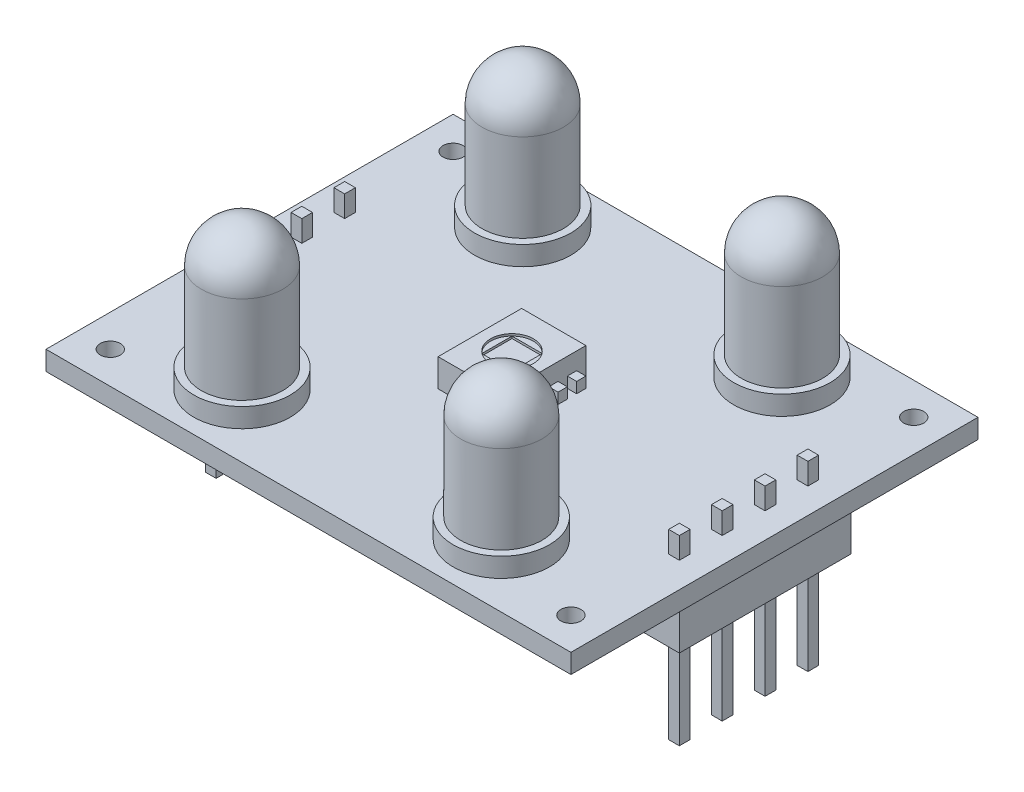
from build123d import *

# Parameters (mm, degrees)
ESQUISSE1_W             = 31.115
ESQUISSE1_H             = 24.13
ESQUISSE1_R             = 0.5953125
BOSS_EXTRU_1_DEPTH      = 0.5715
ESQUISSE2_W             = 3.81
ESQUISSE2_H             = 1.651
BOSS_EXTRU_2_DEPTH      = 2.4765
ESQUISSE3_W             = 0.550333333
ESQUISSE3_H             = 0.550333334
ESQUISSE3_H_2           = 0.550333333
BOSS_EXTRU_3_DEPTH      = 0.635
ESQUISSE9_W             = 2.54
ESQUISSE9_H             = 10.16
BOSS_EXTRU_6_DEPTH      = 2.667
BOSS_EXTRU_7_START      = -5.08
ESQUISSE10_W            = 0.635
ESQUISSE10_H            = 0.635
BOSS_EXTRU_7_DEPTH      = 10.795
ESQUISSE4_R             = 1.27
ENL_V_MAT_EXTRU_1_DEPTH = 0.127
ESQUISSE5_W             = 1.796051224
ESQUISSE5_H             = 1.796051224
ENL_V_MAT_EXTRU_2_DEPTH = 0.127
ESQUISSE7_R             = 2.8575
BOSS_EXTRU_4_DEPTH      = 1.143
ESQUISSE8_R             = 2.413
BOSS_EXTRU_5_DEPTH      = 7.62
CONG_1_R                = 2.413


# Read off the part's stored shape, not the designer's step: Répét. par esquisse1
with BuildPart() as part:
    # Esquisse1 → Boss.-Extru.1 (new, symmetric)
    with BuildSketch(Plane(origin=(0, 0, 0), x_dir=(1, 0, 0), z_dir=(0, 1, 0))):
        Rectangle(ESQUISSE1_W, ESQUISSE1_H)
        with Locations(Location((-13.6525, 10.16, 0), (0, 0, 270))):
            Circle(ESQUISSE1_R, mode=Mode.SUBTRACT)
        with Locations(Location((13.6525, 10.16, 0), (0, 0, 270))):
            Circle(ESQUISSE1_R, mode=Mode.SUBTRACT)
        with Locations(Location((-13.6525, -10.16, 0), (0, 0, 270))):
            Circle(ESQUISSE1_R, mode=Mode.SUBTRACT)
        with Locations(Location((13.6525, -10.16, 0), (0, 0, 270))):
            Circle(ESQUISSE1_R, mode=Mode.SUBTRACT)
    extrude(amount=BOSS_EXTRU_1_DEPTH, both=True)

    # Esquisse2 → Boss.-Extru.2 (add, symmetric)
    with BuildSketch(Plane.XY):
        with Locations((0, 1.397)):
            Rectangle(ESQUISSE2_W, ESQUISSE2_H)
    extrude(amount=BOSS_EXTRU_2_DEPTH, both=True)

    # Esquisse3 → Boss.-Extru.3 (add)
    with BuildSketch(Plane(origin=(0, 0.5715, 0), x_dir=(1, 0, 0), z_dir=(0, 1, 0))):
        with Locations((2.180166666, 1.651)):
            Rectangle(ESQUISSE3_W, ESQUISSE3_H)
        with Locations((2.180166666, 0.550333334)):
            Rectangle(ESQUISSE3_W, ESQUISSE3_H_2)
        with Locations((2.180166666, -0.550333334)):
            Rectangle(ESQUISSE3_W, ESQUISSE3_H_2)
        with Locations((2.180166666, -1.651)):
            Rectangle(ESQUISSE3_W, ESQUISSE3_H)
    boss_extru_3 = extrude(amount=BOSS_EXTRU_3_DEPTH)

    # Esquisse9 → Boss.-Extru.6 (add)
    with BuildSketch(Plane.XZ.offset(0.5715)):
        with Locations((13.73, 0)):
            Rectangle(ESQUISSE9_W, ESQUISSE9_H)
    boss_extru_6 = extrude(amount=BOSS_EXTRU_6_DEPTH)

    # Esquisse10 → Boss.-Extru.7 (add)
    with BuildSketch(Plane.XZ.offset(3.2385).offset(BOSS_EXTRU_7_START)):
        with Locations((13.73, 3.81)):
            Rectangle(ESQUISSE10_W, ESQUISSE10_H)
        with Locations((13.73, 1.27)):
            Rectangle(ESQUISSE10_W, ESQUISSE10_H)
        with Locations((13.73, -1.27)):
            Rectangle(ESQUISSE10_W, ESQUISSE10_H)
        with Locations((13.73, -3.81)):
            Rectangle(ESQUISSE10_W, ESQUISSE10_H)
    boss_extru_7 = extrude(amount=BOSS_EXTRU_7_DEPTH)

    # Symétrie1: Boss.-Extru.3, Boss.-Extru.7 across plane
    add(boss_extru_3.mirror(Plane(origin=(0, 0, 0), x_dir=(0, 0, 1), z_dir=(1, 0, 0))))
    add(boss_extru_7.mirror(Plane(origin=(0, 0, 0), x_dir=(0, 0, 1), z_dir=(1, 0, 0))))

    # Symétrie2: Boss.-Extru.6 across plane
    add(boss_extru_6.mirror(Plane(origin=(0, 0, 0), x_dir=(0, 0, 1), z_dir=(1, 0, 0))))

    # Esquisse4 → Enlèv. mat.-Extru.1 (cut)
    with BuildSketch(Plane(origin=(0, 2.2225, 0), x_dir=(1, 0, 0), z_dir=(0, 1, 0))):
        with Locations(Location((0, 0, 0), (0, 0, 270))):
            Circle(ESQUISSE4_R)
    extrude(amount=-ENL_V_MAT_EXTRU_1_DEPTH, mode=Mode.SUBTRACT)

    # Esquisse5 → Enlèv. mat.-Extru.2 (cut)
    with BuildSketch(Plane(origin=(0, 2.0955, 0), x_dir=(1, 0, 0), z_dir=(0, 1, 0))):
        Rectangle(ESQUISSE5_W, ESQUISSE5_H)
    extrude(amount=-ENL_V_MAT_EXTRU_2_DEPTH, mode=Mode.SUBTRACT)

    # Esquisse7 → Boss.-Extru.4 (add)
    with BuildSketch(Plane(origin=(0, 0.5715, 0), x_dir=(1, 0, 0), z_dir=(0, 1, 0))):
        with Locations(Location((-7.6835, 8.3185, 0), (0, 0, 90))):
            Circle(ESQUISSE7_R)
    extrude(amount=BOSS_EXTRU_4_DEPTH)

    # Esquisse8 → Boss.-Extru.5 (add)
    with BuildSketch(Plane(origin=(0, 1.7145, 0), x_dir=(1, 0, 0), z_dir=(0, 1, 0))):
        with Locations(Location((-7.6835, 8.3185, 0), (0, 0, 90))):
            Circle(ESQUISSE8_R)
    extrude(amount=BOSS_EXTRU_5_DEPTH)

    # Congé1
    cong_1_edges = [part.edges().sort_by_distance(p)[0] for p in [
        (-7.6835, 9.3345, -5.9055),
    ]]
    fillet(cong_1_edges, radius=CONG_1_R)

    # Répét. par esquisse1 outline → Répét. par esquisse1 (revolve)
    with BuildSketch(Plane(origin=(7.6835, 0, -8.3185), x_dir=(1, 0, 0), z_dir=(0, 0, 1))):
        with BuildLine():
            Line((0, 0.5715), (2.8575, 0.5715))
            Line((2.8575, 0.5715), (2.8575, 1.7145))
            Line((2.8575, 1.7145), (2.413, 1.7145))
            Line((2.413, 1.7145), (2.413, 6.921499998))
            ThreePointArc((2.413, 6.921499998), (1.706248664, 8.627748662), (0, 9.3345))
            Line((0, 9.3345), (0, 0.5715))
        make_face()
    revolve(axis=Axis((7.6835, 0, -8.3185), (0, 1, 0)))

    # R_p_t. par esquisse1 2 outline → R_p_t. par esquisse1 2 (revolve)
    with BuildSketch(Plane(origin=(7.6835, 0, 8.3185), x_dir=(1, 0, 0), z_dir=(0, 0, 1))):
        with BuildLine():
            Line((0, 0.5715), (2.8575, 0.5715))
            Line((2.8575, 0.5715), (2.8575, 1.7145))
            Line((2.8575, 1.7145), (2.413, 1.7145))
            Line((2.413, 1.7145), (2.413, 6.921499998))
            ThreePointArc((2.413, 6.921499998), (1.706248664, 8.627748662), (0, 9.3345))
            Line((0, 9.3345), (0, 0.5715))
        make_face()
    revolve(axis=Axis((7.6835, 0, 8.3185), (0, 1, 0)))

    # R_p_t. par esquisse1 3 outline → R_p_t. par esquisse1 3 (revolve)
    with BuildSketch(Plane(origin=(-7.6835, 0, 8.3185), x_dir=(1, 0, 0), z_dir=(0, 0, 1))):
        with BuildLine():
            Line((0, 0.5715), (2.8575, 0.5715))
            Line((2.8575, 0.5715), (2.8575, 1.7145))
            Line((2.8575, 1.7145), (2.413, 1.7145))
            Line((2.413, 1.7145), (2.413, 6.921499998))
            ThreePointArc((2.413, 6.921499998), (1.706248664, 8.627748662), (0, 9.3345))
            Line((0, 9.3345), (0, 0.5715))
        make_face()
    revolve(axis=Axis((-7.6835, 0, 8.3185), (0, 1, 0)))


solid = part.part
